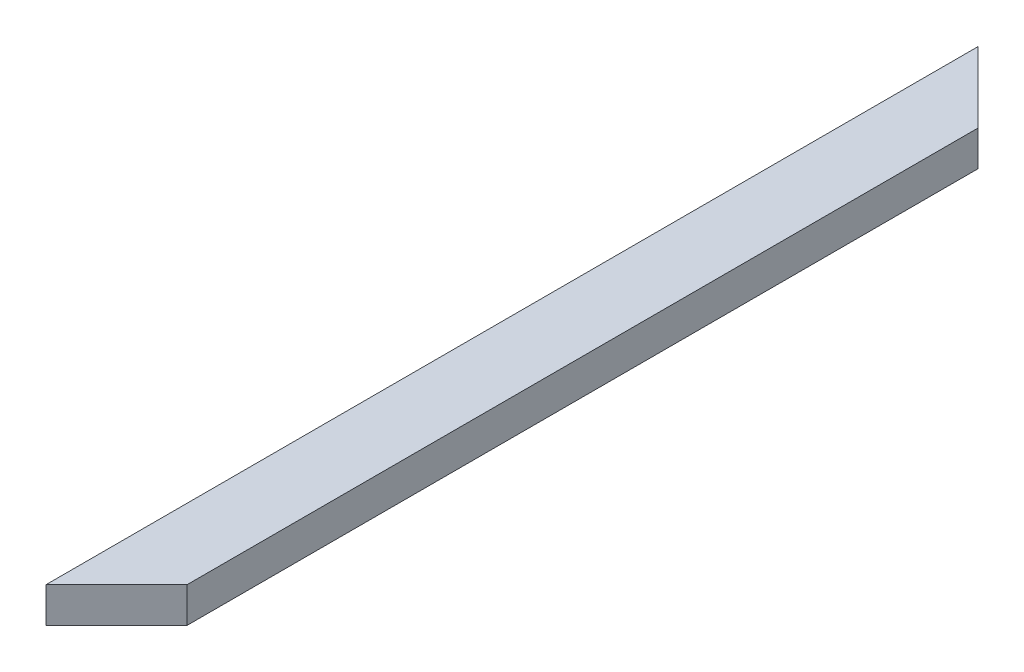
from build123d import *

# Parameters (mm, degrees)
SKETCH1_W           = 14
SKETCH1_H           = 7
BOSS_EXTRUDE1_DEPTH = 185
CUT_EXTRUDE1_DEPTH  = 186.660981361


with BuildPart() as part:
    # Sketch1 → Boss-Extrude1 (new body)
    with BuildSketch(Plane.XY):
        with Locations((7, 3.5)):
            Rectangle(SKETCH1_W, SKETCH1_H)
    extrude(amount=BOSS_EXTRUDE1_DEPTH)

    # Sketch2 → Cut-Extrude1 (cut, through all)
    with BuildSketch(Plane(origin=(0, 7, 0), x_dir=(1, 0, 0), z_dir=(0, 1, 0))):
        Polygon((0, 0), (14, -14), (14, 0), align=None)
        Polygon((14, -185), (0, -185), (14, -171), align=None)
    extrude(amount=-CUT_EXTRUDE1_DEPTH, mode=Mode.SUBTRACT)


solid = part.part
